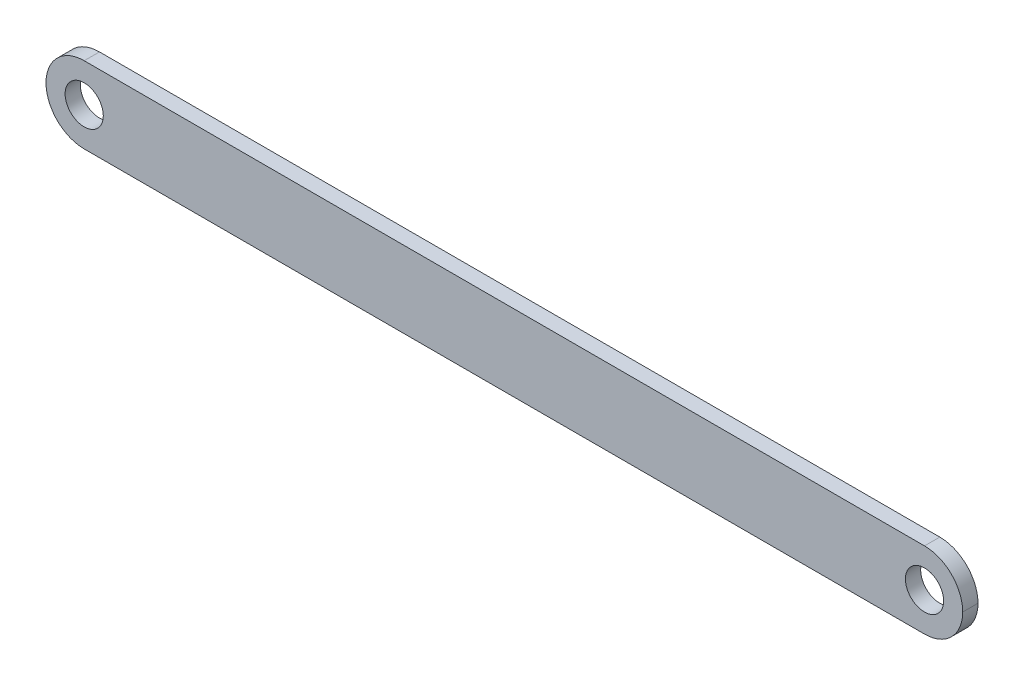
from build123d import *

# Parameters (mm, degrees)
SKETCH1_W           = 152.4
SKETCH1_H           = 12.7
SKETCH1_R           = 3.175
BOSS_EXTRUDE1_DEPTH = 2.54
FILLET2_R           = 6.35
FILLET3_R           = 6.35


with BuildPart() as part:
    # Sketch1 → Boss-Extrude1 (new body)
    with BuildSketch(Plane.XY):
        with Locations((76.2, 6.35)):
            Rectangle(SKETCH1_W, SKETCH1_H)
        with Locations((6.35, 6.35)):
            Circle(SKETCH1_R, mode=Mode.SUBTRACT)
        with Locations((146.05, 6.35)):
            Circle(SKETCH1_R, mode=Mode.SUBTRACT)
    extrude(amount=BOSS_EXTRUDE1_DEPTH)

    # Fillet2
    fillet2_edges = [part.edges().sort_by_distance(p)[0] for p in [
        (0, 0, 1.27),
        (0, 12.7, 1.27),
    ]]
    fillet(fillet2_edges, radius=FILLET2_R - 0.0001)  # a hair under: the kernel refuses the full size

    # Fillet3
    fillet3_edges = [part.edges().sort_by_distance(p)[0] for p in [
        (152.4, 0, 1.27),
        (152.4, 12.7, 1.27),
    ]]
    fillet(fillet3_edges, radius=FILLET3_R - 0.0001)  # a hair under: the kernel refuses the full size


solid = part.part
